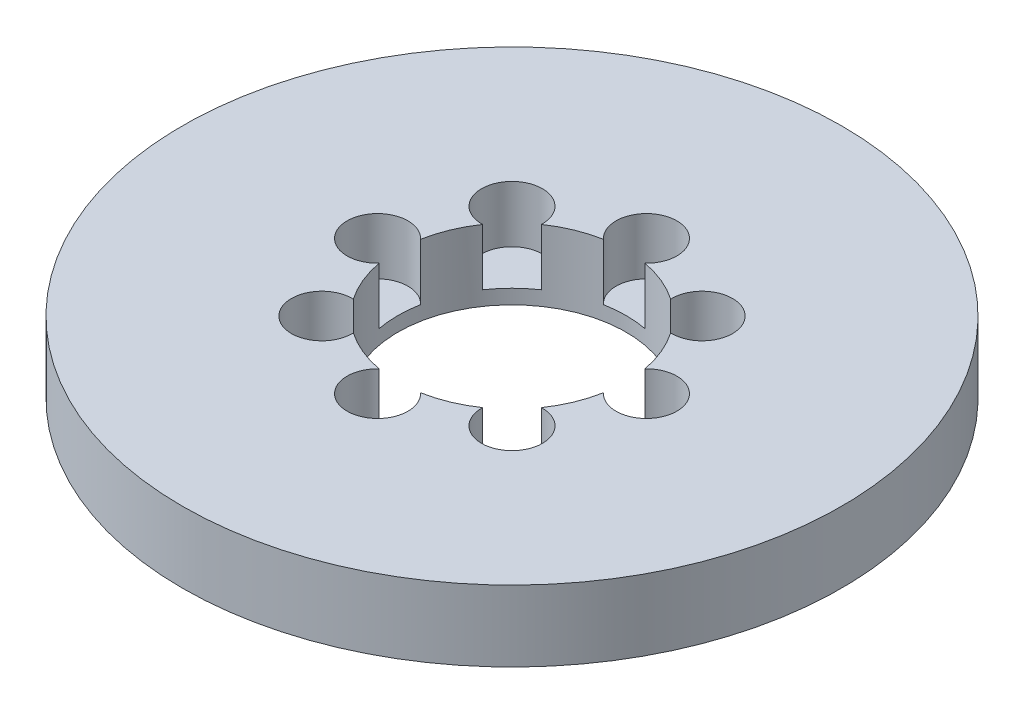
from build123d import *

# Parameters (mm, degrees)
SKETCH1_R           = 65
BOSS_EXTRUDE1_DEPTH = 14
SKETCH2_R           = 22.5
CUT_EXTRUDE1_DEPTH  = 93.983869569
SKETCH3_R           = 6.003081758
CUT_EXTRUDE2_DEPTH  = 11.160170032
CIRPATTERN1_COUNT   = 8


with BuildPart() as part:
    # Sketch1 → Boss-Extrude1 (new body)
    with BuildSketch(Plane(origin=(0, 0, 0), x_dir=(1, 0, 0), z_dir=(0, 1, 0))):
        Circle(SKETCH1_R)
    extrude(amount=BOSS_EXTRUDE1_DEPTH)

    # Sketch2 → Cut-Extrude1 (cut, through all)
    with BuildSketch(Plane(origin=(0, 0, 0), x_dir=(1, 0, 0), z_dir=(0, 1, 0))):
        Circle(SKETCH2_R)
    extrude(amount=CUT_EXTRUDE1_DEPTH, mode=Mode.SUBTRACT)

    # Sketch3 → Cut-Extrude2 (cut)
    with BuildSketch(Plane(origin=(0, 14, 0), x_dir=(1, 0, 0), z_dir=(0, 1, 0))):
        with Locations((-26.519164438, 0)):
            Circle(SKETCH3_R)
    cut_extrude2 = extrude(amount=-CUT_EXTRUDE2_DEPTH, mode=Mode.SUBTRACT)

    # CirPattern1: Cut-Extrude2 ×8 about axis
    cirpattern1_axis = Axis((0, 0, 0), (0, 1, 0))
    for i in range(1, CIRPATTERN1_COUNT):
        add(cut_extrude2.rotate(cirpattern1_axis, i * 360 / CIRPATTERN1_COUNT), mode=Mode.SUBTRACT)


solid = part.part
